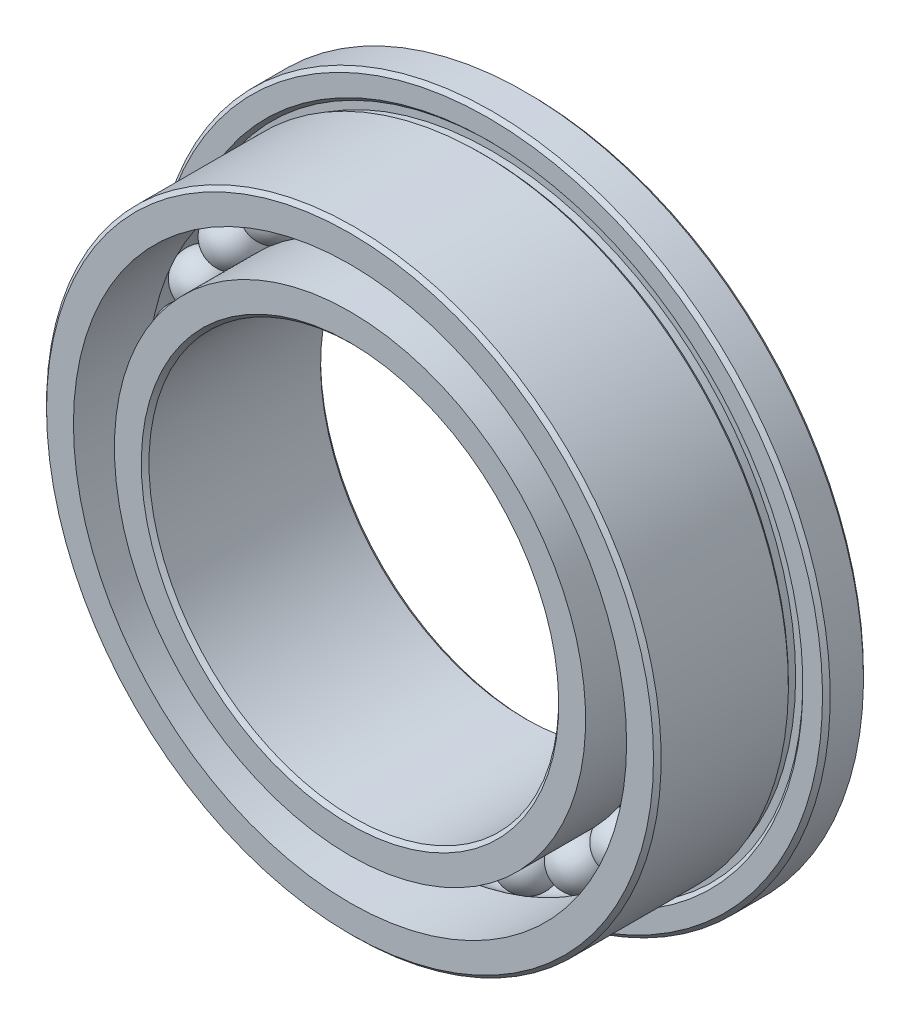
from build123d import *

# Parameters (mm, degrees)
FILLET1_SIZE      = 0.075
FILLET2_SIZE      = 0.075
CIRPATTERN3_COUNT = 27


with BuildPart() as part:
    # Sketch2 → Revolve1 (revolve)
    with BuildSketch(Plane(origin=(0, 0, 0), x_dir=(0, 0, -1), z_dir=(1, 0, 0))):
        with BuildLine():
            Line((1.75, 6.6), (0.95, 6.6))
            Line((0.95, 6.6), (0.95, 6.141421356))
            Line((0.95, 6.141421356), (1.020710678, 6.070710678))
            Line((1.020710678, 6.070710678), (1.020710678, 5.929289322))
            Line((1.020710678, 5.929289322), (0.879289322, 5.929289322))
            Line((0.879289322, 5.929289322), (0.808578644, 6))
            Line((0.808578644, 6), (-1.75, 6))
            Line((-1.75, 6), (-1.75, 5.4))
            Line((-1.75, 5.4), (-0.3, 5.4))
            ThreePointArc((-0.3, 5.4), (0, 5.5), (0.3, 5.4))
            Line((0.3, 5.4), (1.75, 5.4))
            Line((1.75, 5.4), (1.75, 6.6))
        make_face()
        with BuildLine():
            Line((1.75, 4), (-1.75, 4))
            Line((-1.75, 4), (-1.75, 4.6))
            Line((-1.75, 4.6), (-0.3, 4.6))
            ThreePointArc((-0.3, 4.6), (0, 4.5), (0.3, 4.6))
            Line((0.3, 4.6), (1.75, 4.6))
            Line((1.75, 4.6), (1.75, 4))
        make_face()
    revolve(axis=Axis((0, 0, 0), (0, 0, -1)))

    # Fillet1
    fillet1_edges = [part.edges().sort_by_distance(p)[0] for p in [
        (0, -6.6, -1.75),
        (0, -6.6, -0.95),
        (0, -6, 1.75),
    ]]
    chamfer(fillet1_edges, length=FILLET1_SIZE)

    # Fillet2
    fillet2_edges = [part.edges().sort_by_distance(p)[0] for p in [
        (0, -4, -1.75),
        (0, -4, 1.75),
    ]]
    chamfer(fillet2_edges, length=FILLET2_SIZE)


with BuildPart() as body_2:
    # Sketch7 → Revolve3 (revolve)
    with BuildSketch(Plane.XY):
        with BuildLine():
            Line((0, 5.5), (0, 4.5))
            ThreePointArc((0, 4.5), (-0.5, 5), (0, 5.5))
        make_face()
    revolve(axis=Axis((0, 5.5, 0), (0, -1, 0)))


with BuildPart() as cirpattern3_1:
    # CirPattern3: pattern copy
    add(body_2.part.rotate(Axis((0, 0, 0), (0, 0, -1)), 1 * 360 / CIRPATTERN3_COUNT))


with BuildPart() as cirpattern3_2:
    # CirPattern3: pattern copy
    add(body_2.part.rotate(Axis((0, 0, 0), (0, 0, -1)), 2 * 360 / CIRPATTERN3_COUNT))


with BuildPart() as cirpattern3_3:
    # CirPattern3: pattern copy
    add(body_2.part.rotate(Axis((0, 0, 0), (0, 0, -1)), 3 * 360 / CIRPATTERN3_COUNT))


with BuildPart() as cirpattern3_4:
    # CirPattern3: pattern copy
    add(body_2.part.rotate(Axis((0, 0, 0), (0, 0, -1)), 4 * 360 / CIRPATTERN3_COUNT))


with BuildPart() as cirpattern3_5:
    # CirPattern3: pattern copy
    add(body_2.part.rotate(Axis((0, 0, 0), (0, 0, -1)), 5 * 360 / CIRPATTERN3_COUNT))


with BuildPart() as cirpattern3_6:
    # CirPattern3: pattern copy
    add(body_2.part.rotate(Axis((0, 0, 0), (0, 0, -1)), 6 * 360 / CIRPATTERN3_COUNT))


with BuildPart() as cirpattern3_7:
    # CirPattern3: pattern copy
    add(body_2.part.rotate(Axis((0, 0, 0), (0, 0, -1)), 7 * 360 / CIRPATTERN3_COUNT))


with BuildPart() as cirpattern3_8:
    # CirPattern3: pattern copy
    add(body_2.part.rotate(Axis((0, 0, 0), (0, 0, -1)), 8 * 360 / CIRPATTERN3_COUNT))


with BuildPart() as cirpattern3_9:
    # CirPattern3: pattern copy
    add(body_2.part.rotate(Axis((0, 0, 0), (0, 0, -1)), 9 * 360 / CIRPATTERN3_COUNT))


with BuildPart() as cirpattern3_10:
    # CirPattern3: pattern copy
    add(body_2.part.rotate(Axis((0, 0, 0), (0, 0, -1)), 10 * 360 / CIRPATTERN3_COUNT))


with BuildPart() as cirpattern3_11:
    # CirPattern3: pattern copy
    add(body_2.part.rotate(Axis((0, 0, 0), (0, 0, -1)), 11 * 360 / CIRPATTERN3_COUNT))


with BuildPart() as cirpattern3_12:
    # CirPattern3: pattern copy
    add(body_2.part.rotate(Axis((0, 0, 0), (0, 0, -1)), 12 * 360 / CIRPATTERN3_COUNT))


with BuildPart() as cirpattern3_13:
    # CirPattern3: pattern copy
    add(body_2.part.rotate(Axis((0, 0, 0), (0, 0, -1)), 13 * 360 / CIRPATTERN3_COUNT))


with BuildPart() as cirpattern3_14:
    # CirPattern3: pattern copy
    add(body_2.part.rotate(Axis((0, 0, 0), (0, 0, -1)), 14 * 360 / CIRPATTERN3_COUNT))


with BuildPart() as cirpattern3_15:
    # CirPattern3: pattern copy
    add(body_2.part.rotate(Axis((0, 0, 0), (0, 0, -1)), 15 * 360 / CIRPATTERN3_COUNT))


with BuildPart() as cirpattern3_16:
    # CirPattern3: pattern copy
    add(body_2.part.rotate(Axis((0, 0, 0), (0, 0, -1)), 16 * 360 / CIRPATTERN3_COUNT))


with BuildPart() as cirpattern3_17:
    # CirPattern3: pattern copy
    add(body_2.part.rotate(Axis((0, 0, 0), (0, 0, -1)), 17 * 360 / CIRPATTERN3_COUNT))


with BuildPart() as cirpattern3_18:
    # CirPattern3: pattern copy
    add(body_2.part.rotate(Axis((0, 0, 0), (0, 0, -1)), 18 * 360 / CIRPATTERN3_COUNT))


with BuildPart() as cirpattern3_19:
    # CirPattern3: pattern copy
    add(body_2.part.rotate(Axis((0, 0, 0), (0, 0, -1)), 19 * 360 / CIRPATTERN3_COUNT))


with BuildPart() as cirpattern3_20:
    # CirPattern3: pattern copy
    add(body_2.part.rotate(Axis((0, 0, 0), (0, 0, -1)), 20 * 360 / CIRPATTERN3_COUNT))


with BuildPart() as cirpattern3_21:
    # CirPattern3: pattern copy
    add(body_2.part.rotate(Axis((0, 0, 0), (0, 0, -1)), 21 * 360 / CIRPATTERN3_COUNT))


with BuildPart() as cirpattern3_22:
    # CirPattern3: pattern copy
    add(body_2.part.rotate(Axis((0, 0, 0), (0, 0, -1)), 22 * 360 / CIRPATTERN3_COUNT))


with BuildPart() as cirpattern3_23:
    # CirPattern3: pattern copy
    add(body_2.part.rotate(Axis((0, 0, 0), (0, 0, -1)), 23 * 360 / CIRPATTERN3_COUNT))


with BuildPart() as cirpattern3_24:
    # CirPattern3: pattern copy
    add(body_2.part.rotate(Axis((0, 0, 0), (0, 0, -1)), 24 * 360 / CIRPATTERN3_COUNT))


with BuildPart() as cirpattern3_25:
    # CirPattern3: pattern copy
    add(body_2.part.rotate(Axis((0, 0, 0), (0, 0, -1)), 25 * 360 / CIRPATTERN3_COUNT))


with BuildPart() as cirpattern3_26:
    # CirPattern3: pattern copy
    add(body_2.part.rotate(Axis((0, 0, 0), (0, 0, -1)), 26 * 360 / CIRPATTERN3_COUNT))


solid = Compound([part.part, body_2.part, cirpattern3_1.part, cirpattern3_2.part, cirpattern3_3.part, cirpattern3_4.part, cirpattern3_5.part, cirpattern3_6.part, cirpattern3_7.part, cirpattern3_8.part, cirpattern3_9.part, cirpattern3_10.part, cirpattern3_11.part, cirpattern3_12.part, cirpattern3_13.part, cirpattern3_14.part, cirpattern3_15.part, cirpattern3_16.part, cirpattern3_17.part, cirpattern3_18.part, cirpattern3_19.part, cirpattern3_20.part, cirpattern3_21.part, cirpattern3_22.part, cirpattern3_23.part, cirpattern3_24.part, cirpattern3_25.part, cirpattern3_26.part])
